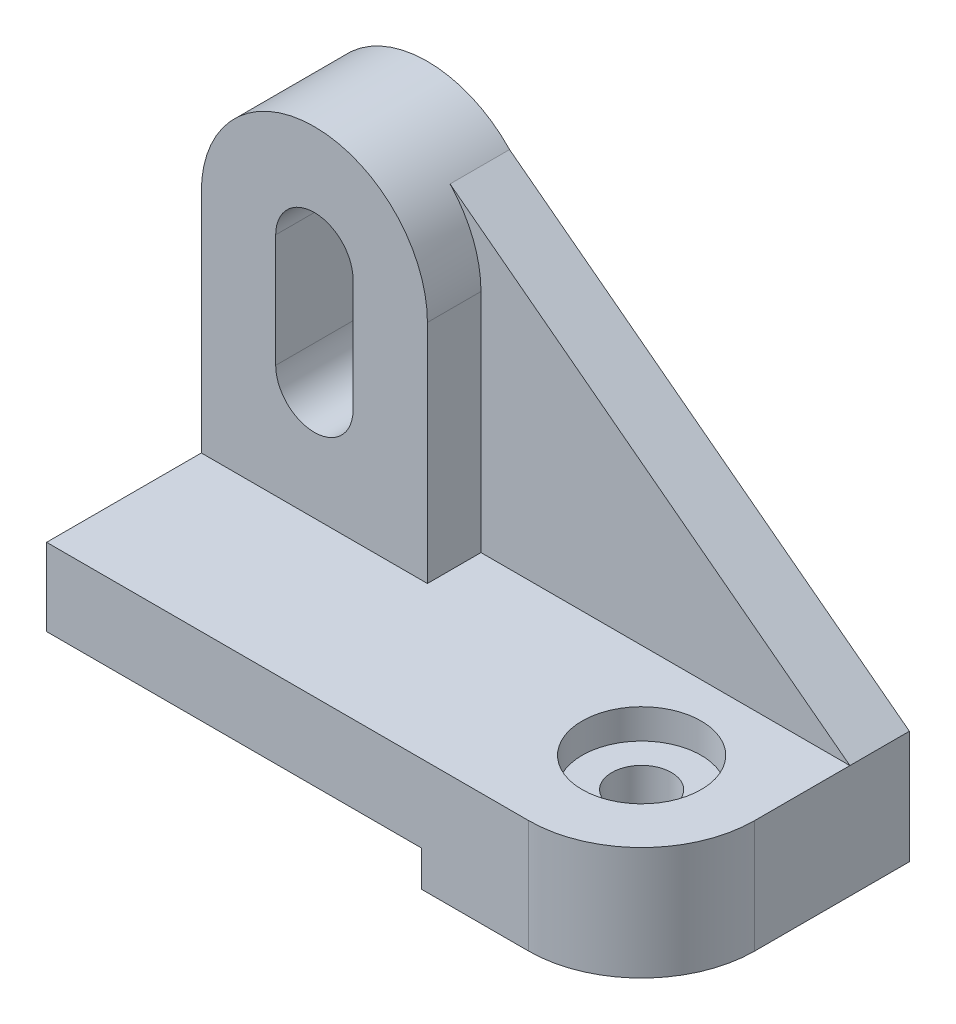
from build123d import *

# Parameters (mm, degrees)
BOSS_EXTRUDE1_DEPTH     = 450
FILLET2_R               = 190
SKETCH2_R               = 100
CUT_EXTRUDE2_DEPTH      = 50
CUT_EXTRUDE4_DEPTH      = 309
CUT_EXTRUDE4_DEPTH_BACK = 506
SKETCH6_R               = 50
BOSS_EXTRUDE2_DEPTH     = 190
RIB9_REACH              = 1302.961
SKETCH10_WALL_W         = 3447.845650616
SKETCH10_WALL_H         = 100


with BuildPart() as part:
    # Sketch1 → Boss-Extrude1 (new body)
    with BuildSketch(Plane.XY):
        Polygon((0, 0), (0, 130), (1000, 130), (1000, -60), (630, -60), (630, 0), align=None)
    extrude(amount=BOSS_EXTRUDE1_DEPTH)

    # Fillet2
    fillet2_edges = [part.edges().sort_by_distance(p)[0] for p in [
        (1000, 35, 450),
    ]]
    fillet(fillet2_edges, radius=FILLET2_R)

    # Sketch2 → Cut-Extrude2 (cut)
    with BuildSketch(Plane(origin=(0, 130, 0), x_dir=(1, 0, 0), z_dir=(0, 1, 0))):
        with Locations((810, -260)):
            Circle(SKETCH2_R)
    extrude(amount=-CUT_EXTRUDE2_DEPTH, mode=Mode.SUBTRACT)

    # Sketch6 → Cut-Extrude4 (cut, two sides: drawn at the far end of the back side and taken through both)
    with BuildSketch(Plane(origin=(0, 80, 0), x_dir=(1, 0, 0), z_dir=(0, 1, 0)).offset(-CUT_EXTRUDE4_DEPTH_BACK)):
        with Locations((810, -260)):
            Circle(SKETCH6_R)
    extrude(amount=CUT_EXTRUDE4_DEPTH + CUT_EXTRUDE4_DEPTH_BACK, mode=Mode.SUBTRACT)

    # Sketch8 → Boss-Extrude2 (add)
    with BuildSketch(Plane(origin=(0, 0, 0), x_dir=(-1, 0, 0), z_dir=(0, 0, -1))):
        with BuildLine():
            Line((-380, 130), (0, 130))
            Line((0, 130), (0, 510))
            ThreePointArc((0, 510), (-125.77886555, 688.817353436), (-336.58574621, 630.882666285))
            ThreePointArc((-336.58574621, 630.882666285), (-368.817353436, 574.22113445), (-380, 510))
            Line((-380, 510), (-380, 130))
        make_face()
        with BuildLine():
            ThreePointArc((-255, 510), (-190, 575), (-125, 510))
            Line((-125, 510), (-125, 320))
            ThreePointArc((-125, 320), (-190, 255), (-255, 320))
            Line((-255, 320), (-255, 510))
        make_face(mode=Mode.SUBTRACT)
    extrude(amount=-BOSS_EXTRUDE2_DEPTH)

    # Sketch10 wall → Rib9 (add, up to next)
    with BuildSketch(Plane(origin=(664.018248416, 385.280022868, 0), x_dir=(-0.796237662378, 0.604983954342, 0), z_dir=(0.604983954342, 0.796237662378, 0)), mode=Mode.PRIVATE) as rib9_sk1:
        with Locations((0, 50)):
            Rectangle(SKETCH10_WALL_W, SKETCH10_WALL_H)
    rib9_tool1 = extrude(rib9_sk1.sketch, amount=-RIB9_REACH, mode=Mode.PRIVATE) - part.part
    add(rib9_tool1.solids().sort_by_distance((664.018248416, 385.280022868, 0))[0])


solid = part.part
